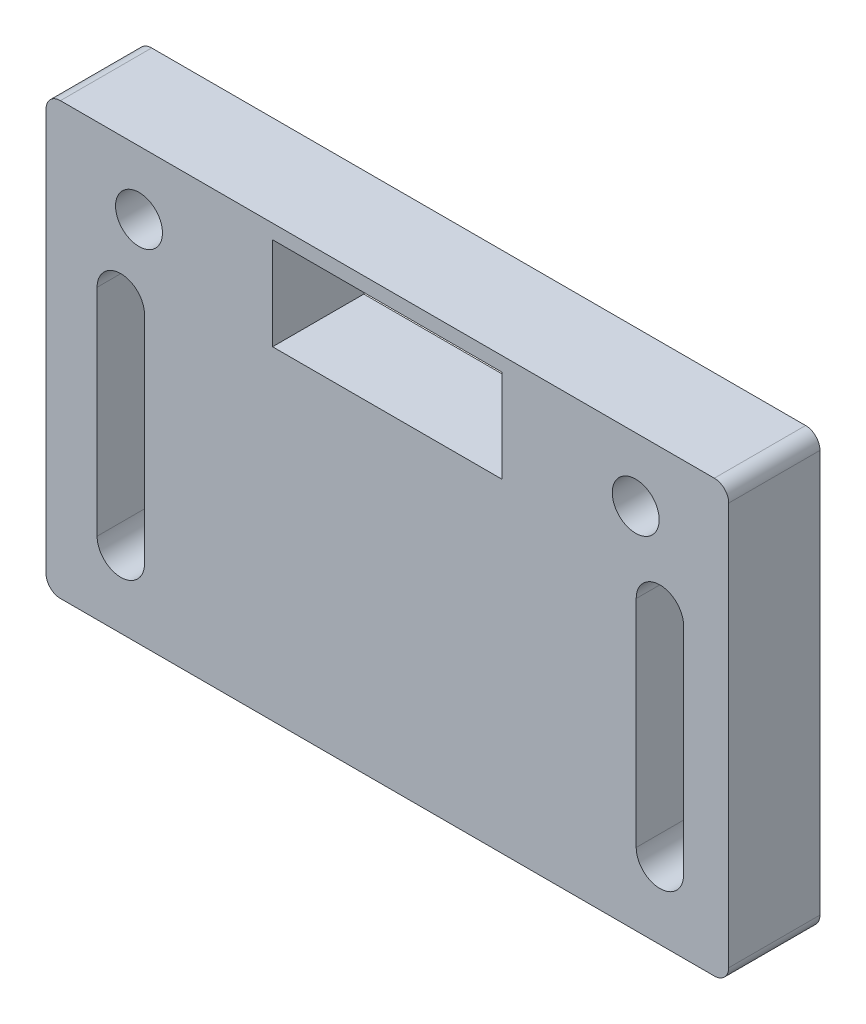
from build123d import *

# Parameters (mm, degrees)
SKETCH1_W                                        = 95
SKETCH1_H                                        = 60
BOSS_EXTRUDE1_DEPTH                              = 12.7
CSK_FOR_1_4_FLAT_HEAD_MACHINE_SCREW2_D           = 6.5278
CSK_FOR_1_4_FLAT_HEAD_MACHINE_SCREW2_CSINK_D     = 12.8778
CSK_FOR_1_4_FLAT_HEAD_MACHINE_SCREW2_CSINK_ANGLE = 82
FILLET1_R                                        = 2
FILLET2_R                                        = 2
CUT_EXTRUDE1_DEPTH                               = 78.572804513


with BuildPart() as part:
    # Sketch1 → Boss-Extrude1 (new body)
    with BuildSketch(Plane.XY):
        with Locations((0, -30)):
            Rectangle(SKETCH1_W, SKETCH1_H)
        Polygon((0, -2), (15.975, -2), (15.975, -14.9), (-15.975, -14.9), (-15.975, -2), align=None, mode=Mode.SUBTRACT)
    extrude(amount=BOSS_EXTRUDE1_DEPTH)

    # CSK for 1/4 Flat Head Machine Screw2 (through all)
    with Locations(Plane(origin=(0, 0, 0), x_dir=(-1, 0, 0), z_dir=(0, 0, -1))):
        with Locations((-34.56, -8.845086615), (34.56, -8.845086615)):
            CounterSinkHole(CSK_FOR_1_4_FLAT_HEAD_MACHINE_SCREW2_D / 2, CSK_FOR_1_4_FLAT_HEAD_MACHINE_SCREW2_CSINK_D / 2, counter_sink_angle=CSK_FOR_1_4_FLAT_HEAD_MACHINE_SCREW2_CSINK_ANGLE)

    # Fillet1
    fillet1_edges = [part.edges().sort_by_distance(p)[0] for p in [
        (-47.5, 0, 6.35),
        (-47.5, -60, 6.35),
    ]]
    fillet(fillet1_edges, radius=FILLET1_R)

    # Fillet2
    fillet2_edges = [part.edges().sort_by_distance(p)[0] for p in [
        (47.5, -60, 6.35),
        (47.5, 0, 6.35),
    ]]
    fillet(fillet2_edges, radius=FILLET2_R)

    # Sketch9 → Cut-Extrude1 (cut, through all)
    with BuildSketch(Plane(origin=(0, 0, 0), x_dir=(-1, 0, 0), z_dir=(0, 0, -1))):
        with BuildLine():
            ThreePointArc((-34.625699417, -19.94085979), (-37.925699417, -16.64085979), (-41.225699417, -19.94085979))
            Line((-41.225699417, -19.94085979), (-41.225699417, -49.94085979))
            ThreePointArc((-41.225699417, -49.94085979), (-37.925699417, -53.24085979), (-34.625699417, -49.94085979))
            Line((-34.625699417, -49.94085979), (-34.625699417, -19.94085979))
        make_face()
        with BuildLine():
            Line((33.794300583, -19.94085979), (33.794300583, -49.94085979))
            ThreePointArc((33.794300583, -49.94085979), (37.094300583, -53.24085979), (40.394300583, -49.94085979))
            Line((40.394300583, -49.94085979), (40.394300583, -19.94085979))
            ThreePointArc((40.394300583, -19.94085979), (37.094300583, -16.64085979), (33.794300583, -19.94085979))
        make_face()
    extrude(amount=-CUT_EXTRUDE1_DEPTH, mode=Mode.SUBTRACT)


solid = part.part
